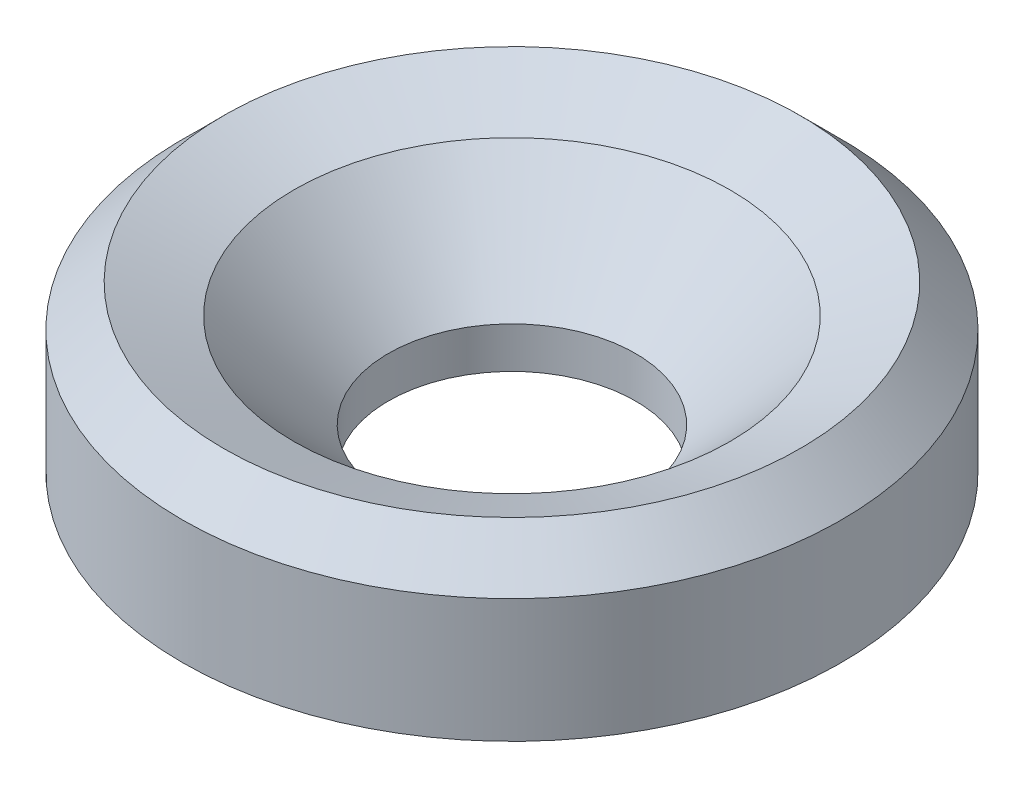
from build123d import *

# Parameters (mm, degrees)
SKETCH_1_R          = 4
EXTRUDE_1_DEPTH     = 2
SKETCH_2_R          = 1.5
CUT_EXTRUDE_1_DEPTH = 7
CHAMFER_1_SIZE      = 1.5
CHAMFER_2_SIZE      = 0.5


with BuildPart() as part:
    # 草图1 → 凸台-拉伸1 (new body)
    with BuildSketch(Plane(origin=(0, 0, 0), x_dir=(1, 0, 0), z_dir=(0, 1, 0))):
        with Locations(Location((0, 0, 0), (0, 0, 270))):
            Circle(SKETCH_1_R)
    extrude(amount=EXTRUDE_1_DEPTH)

    # 草图2 → 切除-拉伸1 (cut, through all)
    with BuildSketch(Plane(origin=(0, 2, 0), x_dir=(1, 0, 0), z_dir=(0, 1, 0))):
        with Locations(Location((0, 0, 0), (0, 0, 270))):
            Circle(SKETCH_2_R)
    extrude(amount=-CUT_EXTRUDE_1_DEPTH, mode=Mode.SUBTRACT)

    # 倒角1
    chamfer_1_edges = [part.edges().sort_by_distance(p)[0] for p in [
        (0, 2, -1.5),
    ]]
    chamfer(chamfer_1_edges, length=CHAMFER_1_SIZE)

    # 倒角2
    chamfer_2_edges = [part.edges().sort_by_distance(p)[0] for p in [
        (0, 2, -3),
        (0, 2, -4),
    ]]
    chamfer(chamfer_2_edges, length=CHAMFER_2_SIZE - 0.0001)  # a hair under: the kernel refuses the full size


solid = part.part
